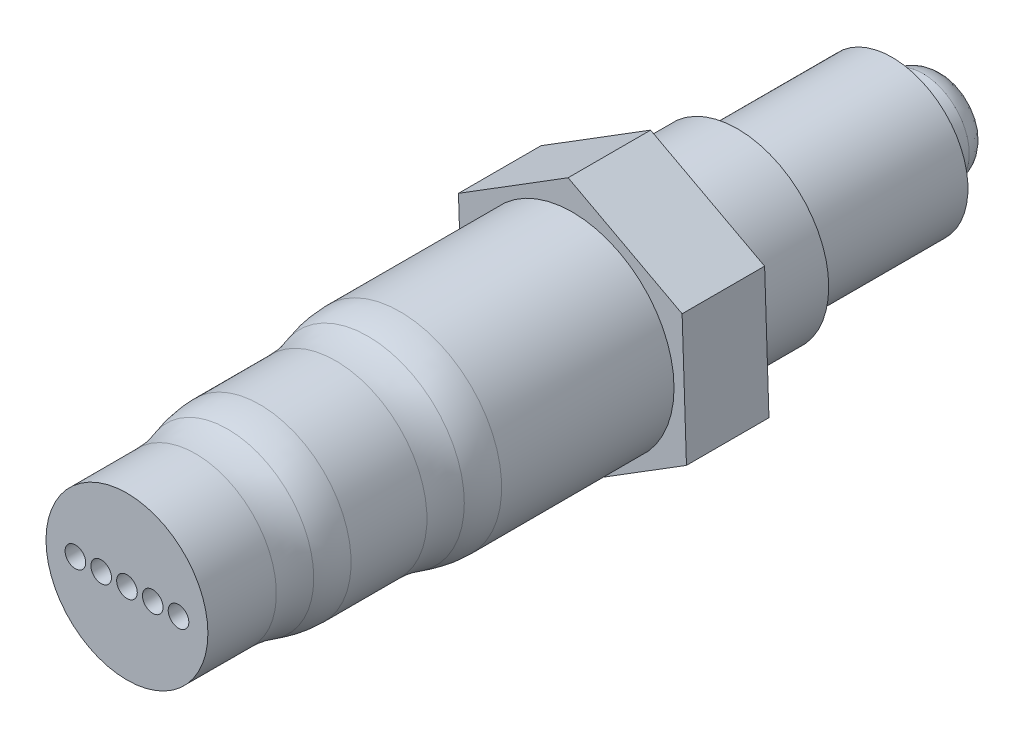
from build123d import *

# Parameters (mm, degrees)
EXTRUDE_1_DEPTH     = 8
SKETCH_2_R          = 9.85
EXTRUDE_2_DEPTH     = 18.6
SKETCH_3_R          = 8.85
EXTRUDE_3_DEPTH     = 13.6
SKETCH_4_R          = 7.85
EXTRUDE_4_DEPTH     = 11
EXTRUDE_START       = 8
SKETCH_8_R          = 8.85
EXTRUDE_7_DEPTH     = 8
SKETCH_9_R          = 7.35
EXTRUDE_8_DEPTH     = 15
SKETCH_10_R         = 4.5
EXTRUDE_9_DEPTH     = 5
FILLET_1_R          = 10
FILLET_2_R          = 10
FILLET_3_R          = 10
FILLET_4_R          = 10
SKETCH_12_R         = 1
CUT_EXTRUDE_1_DEPTH = 2


with BuildPart() as part:
    # ｽｹｯﾁ1 → ﾎﾞｽ - 押し出し1 (new body)
    with BuildSketch(Plane.XY):
        Polygon((11.05453339, -5.895814181), (10.633191552, 6.625599652), (-0.421341838, 12.521413833), (-11.05453339, 5.895814181), (-10.633191552, -6.625599652), (0.421341838, -12.521413833), align=None)
    extrude(amount=EXTRUDE_1_DEPTH)

    # ｽｹｯﾁ2 → ﾎﾞｽ - 押し出し2 (add)
    with BuildSketch(Plane.XY.offset(8)):
        Circle(SKETCH_2_R)
    extrude(amount=EXTRUDE_2_DEPTH)

    # ｽｹｯﾁ3 → ﾎﾞｽ - 押し出し3 (add)
    with BuildSketch(Plane.XY.offset(26.6)):
        Circle(SKETCH_3_R)
    extrude(amount=EXTRUDE_3_DEPTH)

    # ｽｹｯﾁ4 → ﾎﾞｽ - 押し出し4 (add)
    with BuildSketch(Plane.XY.offset(40.2)):
        Circle(SKETCH_4_R)
    extrude(amount=EXTRUDE_4_DEPTH)

    # ｽｹｯﾁ8 → ﾎﾞｽ - 押し出し7 (add)
    with BuildSketch(Plane(origin=(0, 0, 0), x_dir=(-1, 0, 0), z_dir=(0, 0, -1)).offset(EXTRUDE_START)):
        with Locations(Location((0, 0, 0), (0, 0, 180))):
            Circle(SKETCH_8_R)
    extrude(amount=-EXTRUDE_7_DEPTH)

    # ｽｹｯﾁ9 → ﾎﾞｽ - 押し出し8 (add)
    with BuildSketch(Plane(origin=(0, 0, -8), x_dir=(-1, 0, 0), z_dir=(0, 0, -1))):
        Circle(SKETCH_9_R)
    extrude(amount=EXTRUDE_8_DEPTH)

    # ｽｹｯﾁ10 → ﾎﾞｽ - 押し出し9 (add)
    with BuildSketch(Plane(origin=(0, 0, -23), x_dir=(-1, 0, 0), z_dir=(0, 0, -1))):
        Circle(SKETCH_10_R)
    extrude(amount=EXTRUDE_9_DEPTH)

    # ﾌｨﾚｯﾄ1
    # the kernel refuses this fillet: 10 mm, written as the material it adds along each edge
    with BuildSketch(Plane(origin=(0, 0, 26.6), x_dir=(1, 0, 0), z_dir=(0, -1, 0))) as fillet_1_piece_1:
        with BuildLine():
            CenterArc((18.85, 4.358898944), FILLET_1_R, 180, 25.841932763)
            Line((8.85, 4.358898944), (8.65, 4.358898944))
            Line((8.65, 4.358898944), (8.65, 0))
            Line((8.65, 0), (8.85, -0.2))
            ThreePointArc((8.85, -0.2), (9.35, -0.2), (9.67, -0.087177979))
            Line((9.67, -0.087177979), (9.85, 0))
        make_face()
    revolve(axis=Axis((0, 0, 26.6), (0, 0, 1)))

    # ﾌｨﾚｯﾄ2
    fillet_2_edges = [part.edges().sort_by_distance(p)[0] for p in [
        (-9.85, 0, 26.6),
    ]]
    fillet(fillet_2_edges, radius=FILLET_2_R)

    # ﾌｨﾚｯﾄ3
    # the kernel refuses this fillet: 10 mm, written as the material it adds along each edge
    with BuildSketch(Plane(origin=(0, 0, 40.2), x_dir=(1, 0, 0), z_dir=(0, -1, 0))) as fillet_3_piece_1:
        with BuildLine():
            CenterArc((17.85, 4.358898944), FILLET_3_R, 180, 25.841932763)
            Line((7.85, 4.358898944), (7.65, 4.358898944))
            Line((7.65, 4.358898944), (7.65, 0))
            Line((7.65, 0), (7.85, -0.2))
            ThreePointArc((7.85, -0.2), (8.35, -0.2), (8.67, -0.087177979))
            Line((8.67, -0.087177979), (8.85, 0))
        make_face()
    revolve(axis=Axis((0, 0, 40.2), (0, 0, 1)))

    # ﾌｨﾚｯﾄ4
    fillet_4_edges = [part.edges().sort_by_distance(p)[0] for p in [
        (-8.85, 0, 40.2),
    ]]
    fillet(fillet_4_edges, radius=FILLET_4_R)

    # ｽｹｯﾁ11 → ｶｯﾄ - 回転1 (revolve, cut)
    with BuildSketch(Plane(origin=(0, 0, 0), x_dir=(0, 0, -1), z_dir=(1, 0, 0)), mode=Mode.PRIVATE) as cut_revolve_1_sk:
        with BuildLine():
            Line((25.979017437, 4.5), (28, 4.5))
            Line((28, 4.5), (28, 3.012412215))
            add(Edge.make_bspline(
                [(25.979017437, 4.5), (26.824177567, 4.378307252), (27.771962705, 3.927947166), (28, 3.012412215)],
                knots=[0, 0, 0, 0, 1, 1, 1, 1], degree=3))
        make_face()
    revolve(cut_revolve_1_sk.sketch.rotate(Axis((0, 0, -28), (0, 0, 1)), 90), axis=Axis((0, 0, -28), (0, 0, 1)), mode=Mode.SUBTRACT)

    # ｽｹｯﾁ12 → ｶｯﾄ - 押し出し1 (cut)
    with BuildSketch(Plane.XY.offset(51.2)):
        Circle(SKETCH_12_R)
        with Locations((2.5, 0)):
            Circle(SKETCH_12_R)
        with Locations((5, 0)):
            Circle(SKETCH_12_R)
        with Locations(Location((-5, 0, 0), (0, 0, 180))):
            Circle(SKETCH_12_R)
        with Locations(Location((-2.5, 0, 0), (0, 0, 180))):
            Circle(SKETCH_12_R)
    extrude(amount=-CUT_EXTRUDE_1_DEPTH, mode=Mode.SUBTRACT)


solid = part.part
